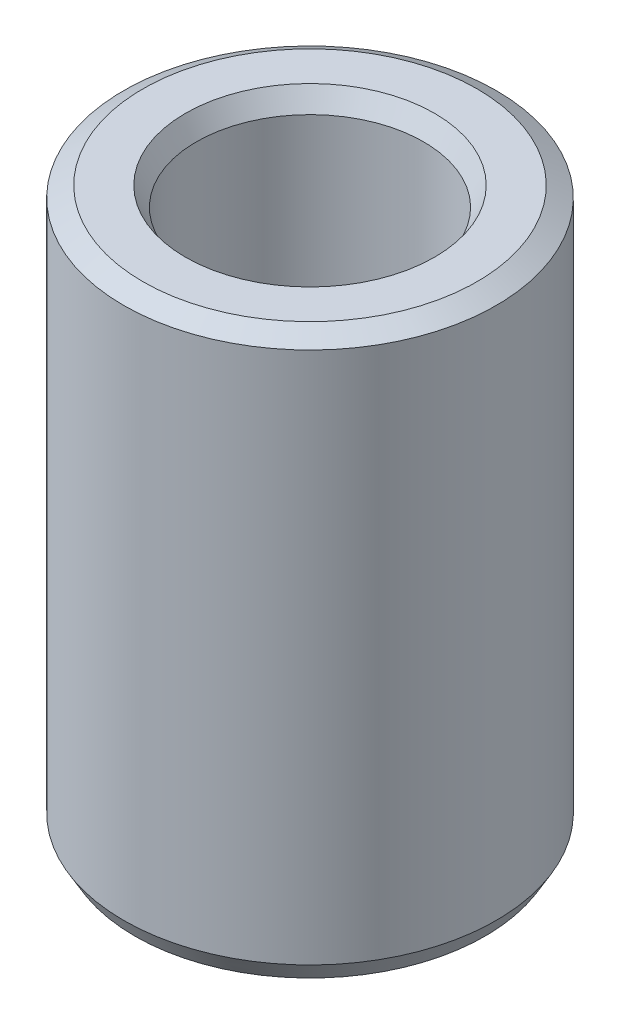
from build123d import *
from OCP.BRepFilletAPI import BRepFilletAPI_MakeChamfer

# Parameters (mm, degrees)
SKETCH1_R           = 52.5
BOSS_EXTRUDE1_DEPTH = 158.669275122
SKETCH2_R           = 32.024468597
CUT_EXTRUDE1_DEPTH  = 176.181160139
CHAMFER1_SIZE       = 3.112519672
CHAMFER1_SIZE2      = 5.391042211


with BuildPart() as part:
    # Sketch1 → Boss-Extrude1 (new body)
    with BuildSketch(Plane(origin=(0, 0, 0), x_dir=(1, 0, 0), z_dir=(0, 1, 0))):
        Circle(SKETCH1_R)
    extrude(amount=BOSS_EXTRUDE1_DEPTH)

    # Sketch2 → Cut-Extrude1 (cut, through all)
    with BuildSketch(Plane(origin=(0, 0, 0), x_dir=(1, 0, 0), z_dir=(0, 1, 0))):
        Circle(SKETCH2_R)
    extrude(amount=CUT_EXTRUDE1_DEPTH, mode=Mode.SUBTRACT)

    # Chamfer1: one chamfer whose edges measure the first distance from different faces: ONE call of the kernel's chamfer builder (chamfer() names one face for all edges)
    chamfer1_edges_1 = [part.edges().sort_by_distance(p)[0] for p in [
        (-32.024468597, 158.669275122, 0),
    ]]
    chamfer1_side_1 = [part.faces().sort_by_distance(p)[0] for p in [
        (-51.01507576, 158.669275122, 0),
    ]]
    chamfer1_edges_2 = [part.edges().sort_by_distance(p)[0] for p in [
        (-32.024468597, 0, 0),
    ]]
    chamfer1_side_2 = [part.faces().sort_by_distance(p)[0] for p in [
        (-32.024468597, 79.334637561, 0),
    ]]
    chamfer1_edges_3 = [part.edges().sort_by_distance(p)[0] for p in [
        (-52.5, 0, 0),
    ]]
    chamfer1_side_3 = [part.faces().sort_by_distance(p)[0] for p in [
        (-51.01507576, 0, 0),
    ]]
    chamfer1_edges_4 = [part.edges().sort_by_distance(p)[0] for p in [
        (-52.5, 158.669275122, 0),
    ]]
    chamfer1_side_4 = [part.faces().sort_by_distance(p)[0] for p in [
        (-52.5, 79.334637561, 0),
    ]]
    chamfer1 = BRepFilletAPI_MakeChamfer(part.part.solid().wrapped)
    for e in chamfer1_edges_1:
        chamfer1.Add(CHAMFER1_SIZE, CHAMFER1_SIZE2, e.wrapped, chamfer1_side_1[0].wrapped)  # the first distance lies on this face
    for e in chamfer1_edges_2:
        chamfer1.Add(CHAMFER1_SIZE, CHAMFER1_SIZE2, e.wrapped, chamfer1_side_2[0].wrapped)  # the first distance lies on this face
    for e in chamfer1_edges_3:
        chamfer1.Add(CHAMFER1_SIZE, CHAMFER1_SIZE2, e.wrapped, chamfer1_side_3[0].wrapped)  # the first distance lies on this face
    for e in chamfer1_edges_4:
        chamfer1.Add(CHAMFER1_SIZE, CHAMFER1_SIZE2, e.wrapped, chamfer1_side_4[0].wrapped)  # the first distance lies on this face
    add(Compound.cast(chamfer1.Shape()), mode=Mode.REPLACE)


solid = part.part
